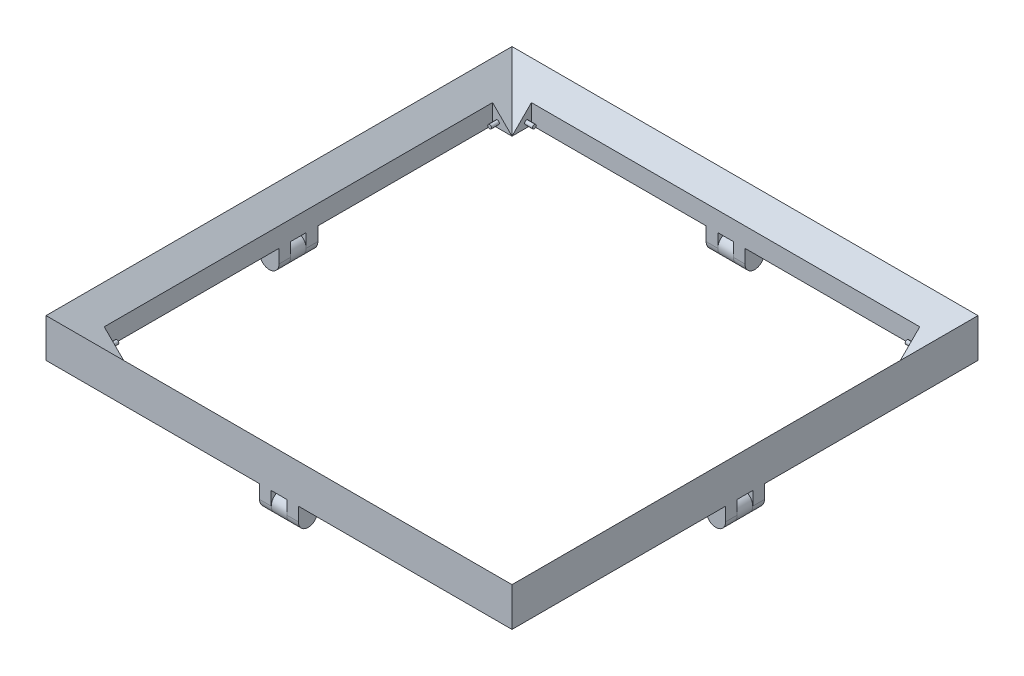
from build123d import *

# Parameters (mm, degrees)
SKETCH1_W                                  = 700
SKETCH1_H                                  = 700
SKETCH1_W_2                                = 500
SKETCH1_H_2                                = 500
BOSS_EXTRUDE2_DEPTH                        = 50
BOSS_EXTRUDE2_DRAFT                        = 45
SKETCH6_W                                  = 700
SKETCH6_H                                  = 700
SKETCH6_W_2                                = 600
SKETCH6_H_2                                = 600
CUT_EXTRUDE1_DEPTH                         = 50
CUT_EXTRUDE2_DEPTH                         = 25
SKETCH8_R                                  = 2.5
BOSS_EXTRUDE3_DEPTH                        = 10
MIRROR1_AT_THE_SECOND_PLANE_COPY_1_SKETC_R = 2.5
MIRROR1_AT_THE_SECOND_PLANE_COPY_1_DEPTH   = 10
MIRROR2_COPY_1_SKETCH_R                    = 2.5
MIRROR2_COPY_1_DEPTH                       = 10
MIRROR2_COPY_2_SKETCH_R                    = 2.5
MIRROR2_COPY_2_DEPTH                       = 10
MIRROR2_COPY_3_SKETCH_R                    = 2.5
MIRROR2_COPY_3_DEPTH                       = 10
SKETCH9_W                                  = 25
SKETCH9_H                                  = 15
BOSS_EXTRUDE4_DEPTH                        = 30
SKETCH11_R                                 = 12.5
BOSS_EXTRUDE5_DEPTH                        = 50
FILLET1_R                                  = 12.5
FILLET1_OF_MIRROR3_R                       = 12.5
MIRROR4_START                              = -25
MIRROR4_OUTLINE_R                          = 12.5
MIRROR4_DEPTH                              = 50
MIRROR4_2_DEPTH                            = 15
MIRROR4_START_2                            = 10
MIRROR4_3_DEPTH                            = 15


# Read off the part's stored shape, not the designer's step: Mirror4
with BuildPart() as part:
    # Sketch1 → Boss-Extrude2 (with draft: the straight prism first)
    with BuildSketch(Plane(origin=(0, 0, 0), x_dir=(1, 0, 0), z_dir=(0, 1, 0))):
        Rectangle(SKETCH1_W, SKETCH1_H)
        Rectangle(SKETCH1_W_2, SKETCH1_H_2, mode=Mode.SUBTRACT)
    extrude(amount=BOSS_EXTRUDE2_DEPTH)
    # Boss-Extrude2: the draft: its side faces are tilted about the plane it starts from
    boss_extrude2_sides = [part.faces().sort_by_distance(p)[0] for p in [
        (-350, 25, 0),
        (0, 25, 350),
        (350, 25, 0),
        (0, 25, -350),
        (250, 25, 0),
        (0, 25, 250),
        (-250, 25, 0),
        (0, 25, -250),
    ]]
    draft(boss_extrude2_sides, Plane(origin=(0, 0, 0), x_dir=(1, 0, 0), z_dir=(0, 1, 0)), BOSS_EXTRUDE2_DRAFT)

    # Sketch6 → Cut-Extrude1 (cut)
    with BuildSketch(Plane(origin=(0, 50, 0), x_dir=(1, 0, 0), z_dir=(0, 1, 0))):
        Rectangle(SKETCH6_W, SKETCH6_H)
        Rectangle(SKETCH6_W_2, SKETCH6_H_2, mode=Mode.SUBTRACT)
    extrude(amount=-CUT_EXTRUDE1_DEPTH, mode=Mode.SUBTRACT)

    # Sketch7 → Cut-Extrude2 (cut)
    with BuildSketch(Plane.XZ):
        Polygon((-275, 250), (-250, 250), (-250, 275), (250, 275), (250, 250), (275, 250), (275, -250), (250, -250), (250, -275), (-250, -275), (-250, -250), (-275, -250), align=None)
    extrude(amount=-CUT_EXTRUDE2_DEPTH, mode=Mode.SUBTRACT)

    # Sketch8 → Boss-Extrude3 (add)
    with BuildSketch(Plane.XY.offset(-250)):
        with Locations(Location((-268.75, 6.25, 0), (0, 0, 180))):
            Circle(SKETCH8_R)
    boss_extrude3 = extrude(amount=BOSS_EXTRUDE3_DEPTH)

    # Mirror1: Boss-Extrude3 across plane
    add(boss_extrude3.mirror(Plane(origin=(0, 0, 0), x_dir=(0, 0, 1), z_dir=(1, 0, 0))))

    # Mirror1 at the second plane: Boss-Extrude3 across plane
    add(boss_extrude3.mirror(Plane.XY))

    # Mirror1 at the second plane copy 1 sketc → Mirror1 at the second plane copy 1 (add)
    with BuildSketch(Plane(origin=(0, 0, 250), x_dir=(-1, 0, 0), z_dir=(0, 0, -1))):
        with Locations(Location((-268.75, 6.25, 0), (0, 0, 180))):
            Circle(MIRROR1_AT_THE_SECOND_PLANE_COPY_1_SKETC_R)
    extrude(amount=MIRROR1_AT_THE_SECOND_PLANE_COPY_1_DEPTH)

    # Mirror2: Boss-Extrude3 across plane
    add(boss_extrude3.mirror(Plane(origin=(0, 0, 0), x_dir=(0.7071067811865477, 0, 0.7071067811865474), z_dir=(-0.7071067811865474, 0, 0.7071067811865477))))

    # Mirror2 copy 1 sketch → Mirror2 copy 1 (add)
    with BuildSketch(Plane(origin=(-250, 0, 0), x_dir=(0, 0, -1), z_dir=(1, 0, 0))):
        with Locations(Location((-268.75, 6.25, 0), (0, 0, 180))):
            Circle(MIRROR2_COPY_1_SKETCH_R)
    extrude(amount=MIRROR2_COPY_1_DEPTH)

    # Mirror2 copy 2 sketch → Mirror2 copy 2 (add)
    with BuildSketch(Plane.ZY.offset(-250)):
        with Locations(Location((-268.75, 6.25, 0), (0, 0, 180))):
            Circle(MIRROR2_COPY_2_SKETCH_R)
    extrude(amount=MIRROR2_COPY_2_DEPTH)

    # Mirror2 copy 3 sketch → Mirror2 copy 3 (add)
    with BuildSketch(Plane(origin=(250, 0, 0), x_dir=(0, 0, -1), z_dir=(-1, 0, 0))):
        with Locations((-268.75, -6.25)):
            Circle(MIRROR2_COPY_3_SKETCH_R)
    extrude(amount=MIRROR2_COPY_3_DEPTH)

    # Sketch9 → Boss-Extrude4 (add)
    with BuildSketch(Plane.XZ):
        with Locations((-287.5, 17.5)):
            Rectangle(SKETCH9_W, SKETCH9_H)
        with Locations((-287.5, -17.5)):
            Rectangle(SKETCH9_W, SKETCH9_H)
    boss_extrude4 = extrude(amount=BOSS_EXTRUDE4_DEPTH)

    # Sketch11 → Boss-Extrude5 (add)
    with BuildSketch(Plane(origin=(0, 0, -25), x_dir=(-1, 0, 0), z_dir=(0, 0, -1))):
        with Locations((287.5, -17.5)):
            Circle(SKETCH11_R)
    boss_extrude5 = extrude(amount=-BOSS_EXTRUDE5_DEPTH)

    # Fillet1
    fillet1_edges = [part.edges().sort_by_distance(p)[0] for p in [
        (-275, -30, -17.5),
        (-275, -30, 17.5),
        (-300, -30, 17.5),
        (-300, -30, -17.5),
    ]]
    fillet(fillet1_edges, radius=FILLET1_R - 0.0001)  # a hair under: the kernel refuses the full size

    # Mirror3: Boss-Extrude4, Boss-Extrude5 across plane
    add(boss_extrude4.mirror(Plane(origin=(0, 0, 0), x_dir=(0, 0, 1), z_dir=(1, 0, 0))))
    add(boss_extrude5.mirror(Plane(origin=(0, 0, 0), x_dir=(0, 0, 1), z_dir=(1, 0, 0))))

    # Fillet1 of Mirror3
    fillet1_of_mirror3_edges = [part.edges().sort_by_distance(p)[0] for p in [
        (275, -30, -17.5),
        (275, -30, 17.5),
        (300, -30, 17.5),
        (300, -30, -17.5),
    ]]
    fillet(fillet1_of_mirror3_edges, radius=FILLET1_OF_MIRROR3_R - 0.0001)  # a hair under: the kernel refuses the full size



with BuildPart() as body_2:
    # Mirror4 outline → Mirror4 (new body)
    with BuildSketch(Plane.YZ.offset(MIRROR4_START)):
        with Locations((-17.5, 287.5)):
            Circle(MIRROR4_OUTLINE_R)
        with Locations((-17.5, -287.5)):
            Circle(MIRROR4_OUTLINE_R)
    extrude(amount=MIRROR4_DEPTH)


with BuildPart() as part_1:
    add(part.part)

    add(body_2.part)  # Mirror4 2 merges body 2
    # Mirror4 2 outline → Mirror4 2 (add)
    with BuildSketch(Plane.YZ.offset(MIRROR4_START)):
        with BuildLine():
            ThreePointArc((-17.5, 300), (-5, 287.5), (-17.5, 275))
            Line((-17.5, 275), (0, 275))
            Line((0, 275), (0, 300))
            Line((0, 300), (-17.5, 300))
        make_face()
        with BuildLine():
            ThreePointArc((-17.5, -275), (-5, -287.5), (-17.5, -300))
            Line((-17.5, -300), (0, -300))
            Line((0, -300), (0, -275))
            Line((0, -275), (-17.5, -275))
        make_face()
    extrude(amount=MIRROR4_2_DEPTH)

    # Mirror4 3 outline → Mirror4 3 (add)
    with BuildSketch(Plane.YZ.offset(MIRROR4_START_2)):
        with BuildLine():
            ThreePointArc((-17.5, 300), (-5, 287.5), (-17.5, 275))
            Line((-17.5, 275), (0, 275))
            Line((0, 275), (0, 300))
            Line((0, 300), (-17.5, 300))
        make_face()
        with BuildLine():
            ThreePointArc((-17.5, -275), (-5, -287.5), (-17.5, -300))
            Line((-17.5, -300), (0, -300))
            Line((0, -300), (0, -275))
            Line((0, -275), (-17.5, -275))
        make_face()
    extrude(amount=MIRROR4_3_DEPTH)


solid = part_1.part
